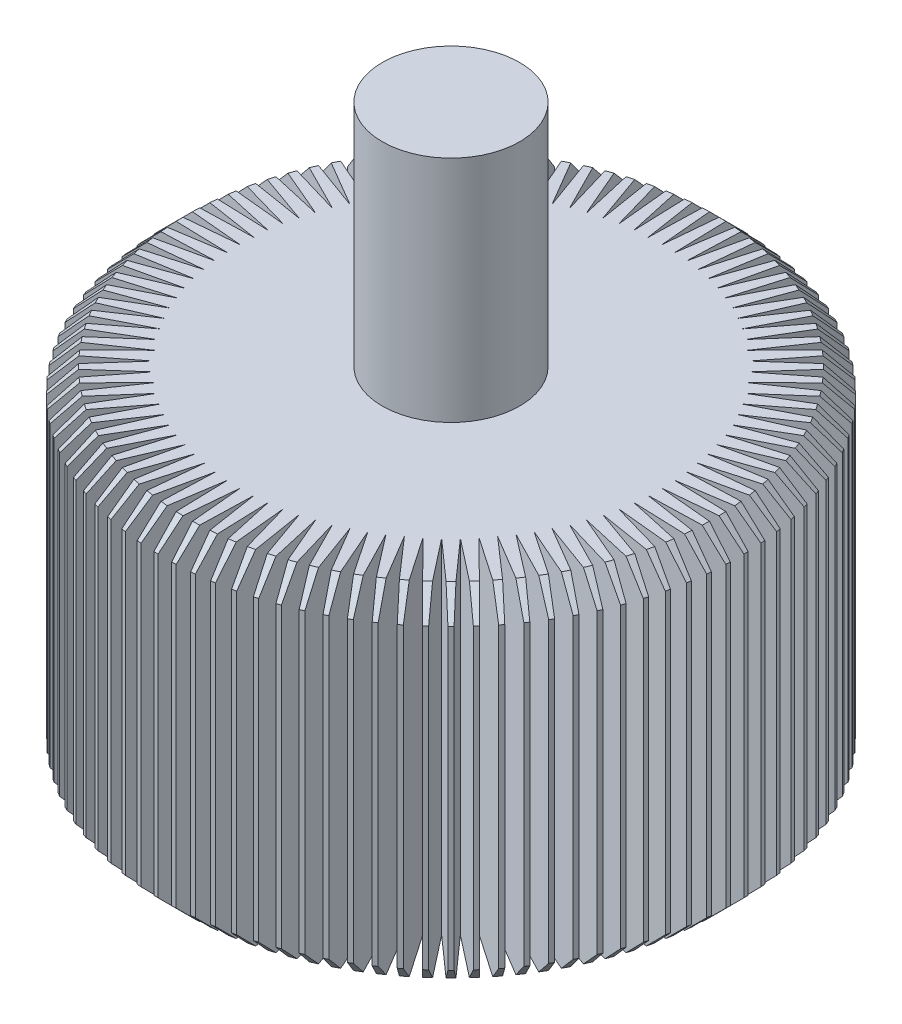
from build123d import *

# Parameters (mm, degrees)
SKETCH_1_R               = 12.5
EXTRUDE_1_DEPTH          = 15
SKETCH_2_R               = 3
EXTRUDE_2_DEPTH          = 10
CHAMFER_1_SIZE           = 1
CUT_EXTRUDE_1_REACH      = 25.184
PATTERN_CIRCULAR_1_COUNT = 100


with BuildPart() as part:
    # 草图1 → 凸台-拉伸1 (new body)
    with BuildSketch(Plane(origin=(0, 0, 0), x_dir=(1, 0, 0), z_dir=(0, 1, 0))):
        Circle(SKETCH_1_R)
    extrude(amount=EXTRUDE_1_DEPTH)

    # 草图2 → 凸台-拉伸2 (add)
    with BuildSketch(Plane(origin=(0, 15, 0), x_dir=(1, 0, 0), z_dir=(0, 1, 0))):
        Circle(SKETCH_2_R)
    extrude(amount=EXTRUDE_2_DEPTH)

    # 倒角1
    chamfer_1_edges = [part.edges().sort_by_distance(p)[0] for p in [
        (-12.5, 0, 0),
        (-12.5, 15, 0),
    ]]
    chamfer(chamfer_1_edges, length=CHAMFER_1_SIZE)

    # 草图3 → 切除-拉伸1 (cut, up to next)
    with BuildSketch(Plane(origin=(0, 15, 0), x_dir=(1, 0, 0), z_dir=(0, 1, 0)), mode=Mode.PRIVATE) as cut_extrude_1_sk1:
        with BuildLine():
            Line((-0.298405581, 12.496437657), (0, 9.2))
            Line((0, 9.2), (0.298405581, 12.496437657))
            ThreePointArc((0.298405581, 12.496437657), (0, 12.5), (-0.298405581, 12.496437657))
        make_face()
    cut_extrude_1_tool1 = extrude(cut_extrude_1_sk1.sketch, amount=-CUT_EXTRUDE_1_REACH, mode=Mode.PRIVATE) & part.part
    cut_extrude_1 = cut_extrude_1_tool1.solids().sort_by_distance((0, 15, -11.399208))[0]
    add(cut_extrude_1, mode=Mode.SUBTRACT)

    # 阵列(圆周)1: 切除-拉伸1 ×100 about axis
    pattern_circular_1_axis = Axis((0, 15, 0), (0, -1, 0))
    for i in range(1, PATTERN_CIRCULAR_1_COUNT):
        add(cut_extrude_1.rotate(pattern_circular_1_axis, i * 360 / PATTERN_CIRCULAR_1_COUNT), mode=Mode.SUBTRACT)


solid = part.part
